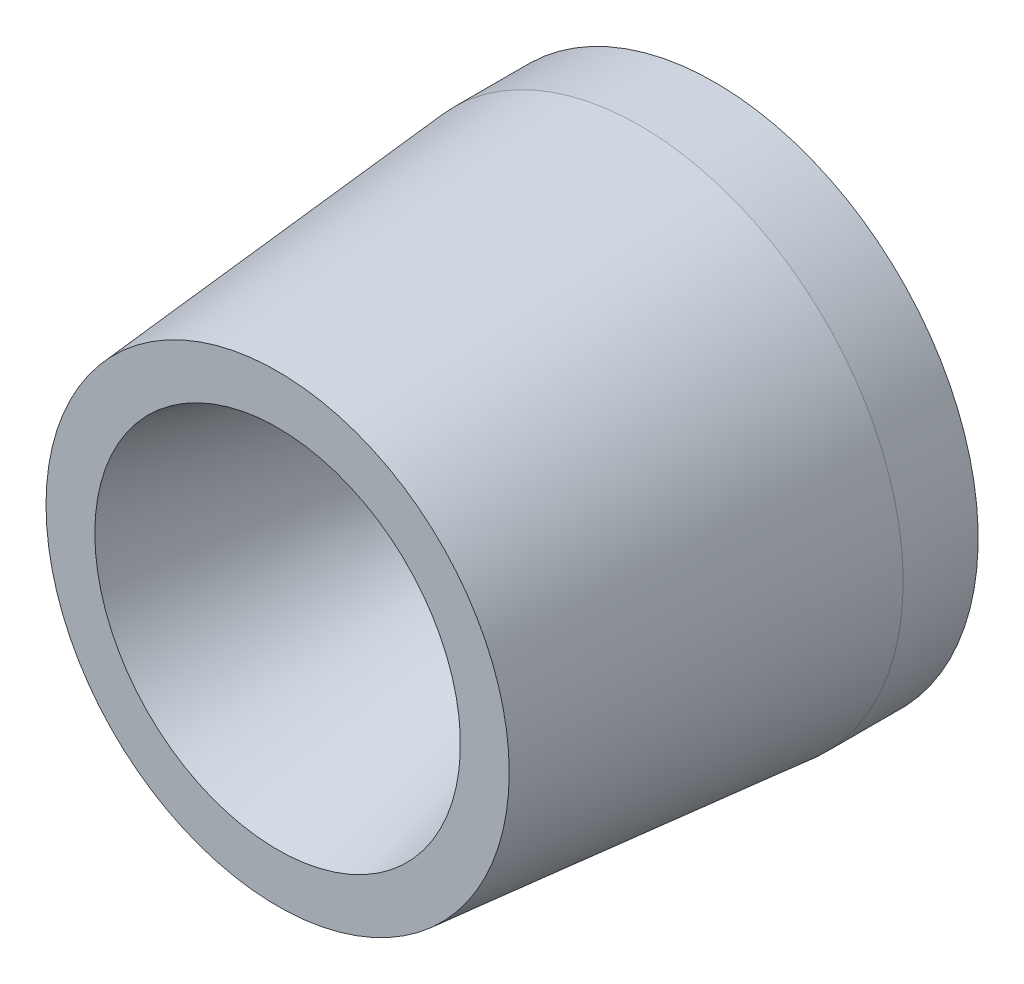
from build123d import *


with BuildPart() as part:
    # Sketch1 → Revolve1 (revolve)
    with BuildSketch(Plane(origin=(0, 0, 0), x_dir=(1, 0, 0), z_dir=(0, 1, 0))):
        Polygon((44.323, 130.833403353), (44.323, 143.454534929), (18.415, 128.496544155), (18.415, 120.876544155), (32.087521299, 69.85), (38.987643543, 69.85), (39.543196557, 76.2), (39.544164949, 76.211068779), (42.87748303, 114.311068779), align=None)
    revolve(axis=Axis((0, 0, -146.817261676), (0, 0, 1)))

    # Sketch2 → Revolve2 (revolve)
    with BuildSketch(Plane(origin=(0, 0, 0), x_dir=(1, 0, 0), z_dir=(0, 1, 0))):
        Polygon((18.415, 120.876544155), (18.415, 115.969640957), (30.77272055, 69.85), (32.087521299, 69.85), align=None)
        Polygon((18.415, 129.963013839), (41.783, 143.454534929), (44.323, 143.454534929), (18.415, 128.496544155), align=None)
    revolve(axis=Axis((0, 0, -146.817261676), (0, 0, 1)))


solid = part.part
